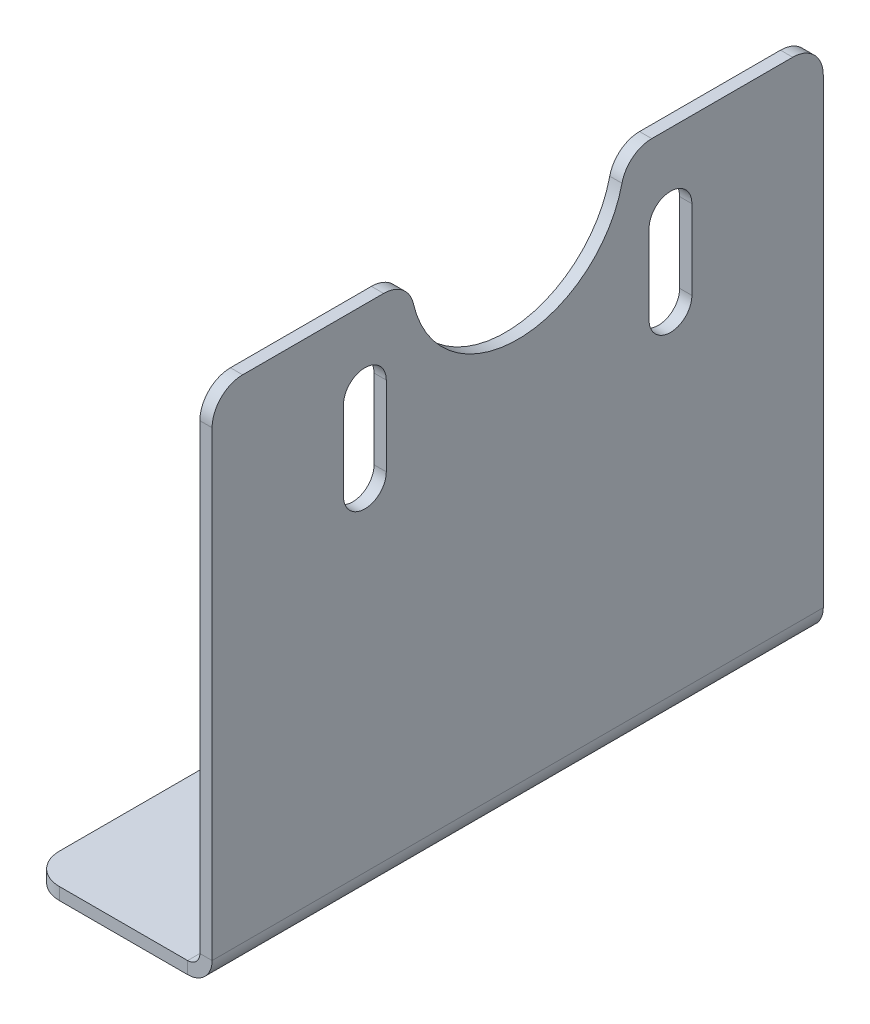
from build123d import *

# Parameters (mm, degrees)
BASE_FLANGE1_DEPTH = 100
SKETCH6_R          = 17.5
CUT_EXTRUDE1_DEPTH = 10
FILLET1_R          = 5
FILLET2_R          = 5
SKETCH7_R          = 3
CUT_EXTRUDE2_DEPTH = 10
CUT_EXTRUDE3_DEPTH = 10


# Sheet-metal steps are written as plain solids
with BuildPart() as part:
    # Sketch1 → Base-Flange1 (new body)
    with BuildSketch(Plane.XY):
        with BuildLine():
            Line((0, 84.5), (0, 4))
            ThreePointArc((0, 4), (-1.171572875, 1.171572875), (-4, 0))
            Line((-4, 0), (-30, 0))
            Line((-30, 0), (-30, 2))
            Line((-30, 2), (-4, 2))
            ThreePointArc((-4, 2), (-2.585786438, 2.585786438), (-2, 4))
            Line((-2, 4), (-2, 84.5))
            Line((-2, 84.5), (0, 84.5))
        make_face()
    extrude(amount=BASE_FLANGE1_DEPTH)

    # Sketch6 → Cut-Extrude1 (cut)
    with BuildSketch(Plane.ZY.offset(2)):
        with Locations((50, 84.5)):
            Circle(SKETCH6_R)
    extrude(amount=-CUT_EXTRUDE1_DEPTH, mode=Mode.SUBTRACT)

    # Fillet1
    fillet1_edges = [part.edges().sort_by_distance(p)[0] for p in [
        (-1, 84.5, 100),
        (-1, 84.5, 32.5),
        (-1, 84.5, 67.5),
        (-1, 84.5, 0),
    ]]
    fillet(fillet1_edges, radius=FILLET1_R)

    # Fillet2
    fillet2_edges = [part.edges().sort_by_distance(p)[0] for p in [
        (-30, 1, 100),
        (-30, 1, 0),
    ]]
    fillet(fillet2_edges, radius=FILLET2_R)

    # Sketch7 → Cut-Extrude2 (cut)
    with BuildSketch(Plane(origin=(0, 2, 0), x_dir=(1, 0, 0), z_dir=(0, 1, 0))):
        with Locations(Location((-15, -25, 0), (0, 0, 270))):
            Circle(SKETCH7_R)
        with Locations(Location((-15, -75, 0), (0, 0, 270))):
            Circle(SKETCH7_R)
    extrude(amount=-CUT_EXTRUDE2_DEPTH, mode=Mode.SUBTRACT)

    # Sketch8 → Cut-Extrude3 (cut)
    with BuildSketch(Plane.ZY.offset(2)):
        with BuildLine():
            Line((21.5, 72), (21.5, 59))
            ThreePointArc((21.5, 59), (25, 55.5), (28.5, 59))
            Line((28.5, 59), (28.5, 72))
            ThreePointArc((28.5, 72), (25, 75.5), (21.5, 72))
        make_face()
        with BuildLine():
            Line((78.5, 72), (78.5, 59))
            ThreePointArc((78.5, 59), (75, 55.5), (71.5, 59))
            Line((71.5, 59), (71.5, 72))
            ThreePointArc((71.5, 72), (75, 75.5), (78.5, 72))
        make_face()
    extrude(amount=-CUT_EXTRUDE3_DEPTH, mode=Mode.SUBTRACT)


solid = part.part
